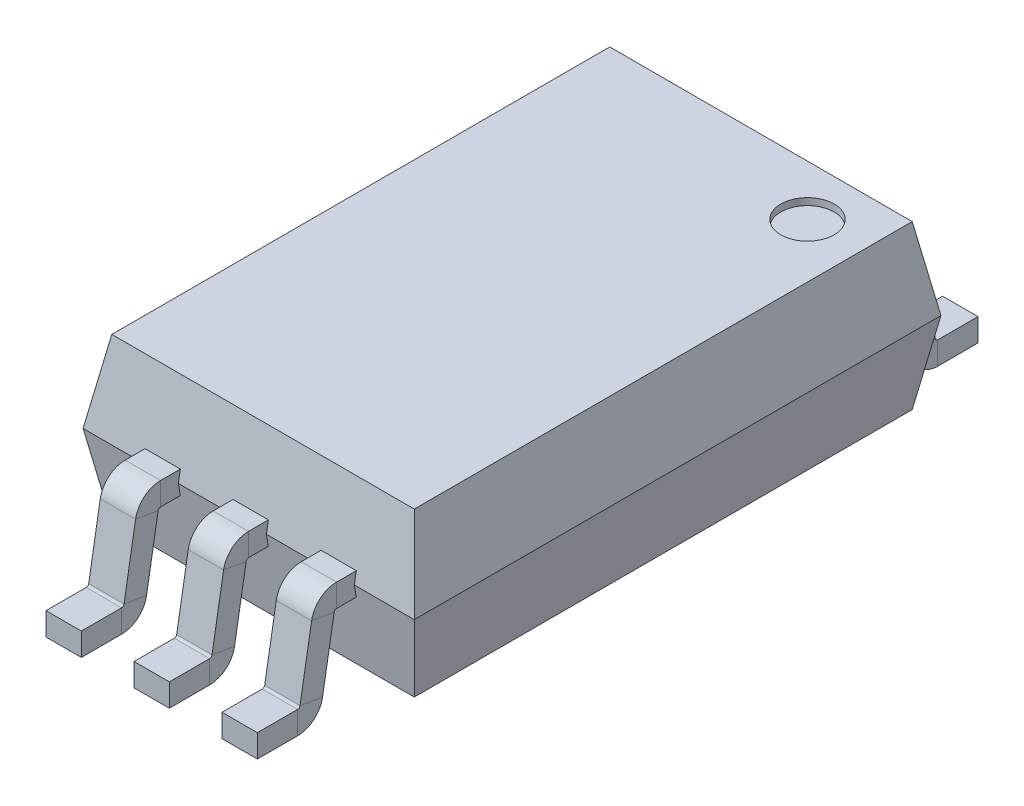
from build123d import *

# Parameters (mm, degrees)
SKETCH1_W           = 4.78
SKETCH1_H           = 7.6
BOSS_EXTRUDE1_DEPTH = 1.175
DRAFT1_START        = -2.39
DRAFT1_DEPTH        = 4.78
DRAFT1_START_2      = -5
DRAFT1_2_DEPTH      = 10
DRAFT2_START        = -2.39
DRAFT2_DEPTH        = 4.78
DRAFT2_START_2      = -5
DRAFT2_2_DEPTH      = 10
SKETCH2_W           = 0.51
SKETCH2_H           = 0.33
SKETCH5_R           = 0.385012942
CUT_EXTRUDE1_DEPTH  = 0.1


with BuildPart() as part:
    # Sketch1 → Boss-Extrude1 (new, symmetric)
    with BuildSketch(Plane(origin=(0, 0, 0), x_dir=(1, 0, 0), z_dir=(0, 1, 0))):
        Rectangle(SKETCH1_W, SKETCH1_H)
    extrude(amount=BOSS_EXTRUDE1_DEPTH, both=True)

    # Draft1: read off the stored shape, not the designer's step
    # Draft1 outline → Draft1 (cut)
    with BuildSketch(Plane.YZ.offset(DRAFT1_START)):
        Polygon((0, 3.8), (1.175, 3.592815798), (1.175, 3.8), align=None)
        Polygon((1.175, -3.592815798), (0, -3.8), (1.175, -3.8), align=None)
    extrude(amount=DRAFT1_DEPTH, mode=Mode.SUBTRACT)

    # Draft1 2 outline → Draft1 2 (cut)
    with BuildSketch(Plane.XY.offset(DRAFT1_START_2)):
        Polygon((2.39, 1.175), (2.182815798, 1.175), (2.39, 0), align=None)
        Polygon((-2.39, 0), (-2.182815798, 1.175), (-2.39, 1.175), align=None)
    extrude(amount=DRAFT1_2_DEPTH, mode=Mode.SUBTRACT)

    # Draft2: read off the stored shape, not the designer's step
    # Draft2 outline → Draft2 (cut)
    with BuildSketch(Plane.YZ.offset(DRAFT2_START)):
        Polygon((0, -3.8), (-1.175, -3.592815798), (-1.175, -3.8), align=None)
        Polygon((-1.175, 3.592815798), (0, 3.8), (-1.175, 3.8), align=None)
    extrude(amount=DRAFT2_DEPTH, mode=Mode.SUBTRACT)

    # Draft2 2 outline → Draft2 2 (cut)
    with BuildSketch(Plane.XY.offset(DRAFT2_START_2)):
        Polygon((-2.39, -1.175), (-2.182815798, -1.175), (-2.39, 0), align=None)
        Polygon((2.39, 0), (2.182815798, -1.175), (2.39, -1.175), align=None)
    extrude(amount=DRAFT2_2_DEPTH, mode=Mode.SUBTRACT)

    # Sweep1: sweep along a path in Sketch3
    with BuildLine(Plane(origin=(0, 0, 0), x_dir=(0, 0, -1), z_dir=(1, 0, 0))) as sweep1_path:
        Line((-5.2, -1.31), (-4.618685307, -1.31))
        ThreePointArc((-4.618685307, -1.31), (-4.489740009, -1.262882667), (-4.421550295, -1.1437311))
        Line((-4.421550295, -1.1437311), (-4.254300072, -0.1662689))
        ThreePointArc((-4.254300072, -0.1662689), (-4.186110358, -0.047117333), (-4.05716506, 0))
        Line((-4.05716506, 0), (-3.8, 0))
        Line((-3.8, 0), (-2.8, 0))
    # Sketch2 → Sweep1 (sweep)
    with BuildSketch(Plane.XY.offset(3.8)):
        Rectangle(SKETCH2_W, SKETCH2_H)
        with Locations((1.27, 0)):
            Rectangle(SKETCH2_W, SKETCH2_H)
        with Locations((-1.27, 0)):
            Rectangle(SKETCH2_W, SKETCH2_H)
    sweep1 = sweep(path=sweep1_path.line)

    # Mirror1: Sweep1 across plane
    add(sweep1.mirror(Plane.XY))

    # Sketch5 → Cut-Extrude1 (cut)
    with BuildSketch(Plane(origin=(0, 1.175, 0), x_dir=(1, 0, 0), z_dir=(0, 1, 0))):
        with Locations(Location((1.399803613, 2.864403821, 0), (0, 0, 270))):
            Circle(SKETCH5_R)
    extrude(amount=-CUT_EXTRUDE1_DEPTH, mode=Mode.SUBTRACT)


solid = part.part
